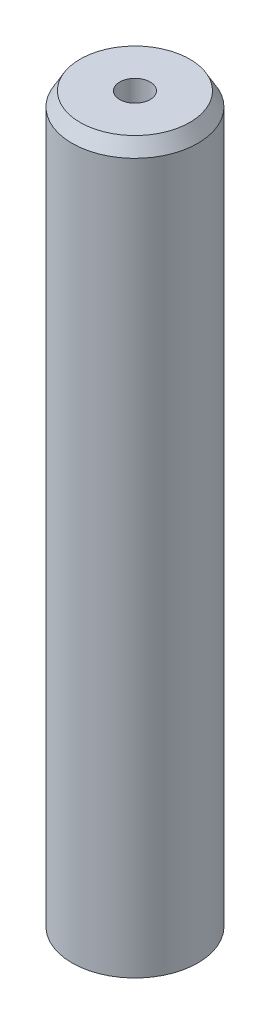
from build123d import *
from OCP.BRepFilletAPI import BRepFilletAPI_MakeChamfer

# Parameters (mm, degrees)
SKETCH1_R           = 7.5
BOSS_EXTRUDE1_DEPTH = 87.214622053
SKETCH2_R           = 1.815469713
CUT_EXTRUDE1_DEPTH  = 88.857215411
CHAMFER1_SIZE       = 1.671019409
CHAMFER1_SIZE2      = 0.964763506


with BuildPart() as part:
    # Sketch1 → Boss-Extrude1 (new body)
    with BuildSketch(Plane(origin=(0, 0, 0), x_dir=(1, 0, 0), z_dir=(0, 1, 0))):
        Circle(SKETCH1_R)
    extrude(amount=BOSS_EXTRUDE1_DEPTH)

    # Sketch2 → Cut-Extrude1 (cut, through all)
    with BuildSketch(Plane(origin=(0, 0, 0), x_dir=(1, 0, 0), z_dir=(0, 1, 0))):
        Circle(SKETCH2_R)
    extrude(amount=CUT_EXTRUDE1_DEPTH, mode=Mode.SUBTRACT)

    # Chamfer1: one chamfer whose edges measure the first distance from different faces: ONE call of the kernel's chamfer builder (chamfer() names one face for all edges)
    chamfer1_edges_1 = [part.edges().sort_by_distance(p)[0] for p in [
        (-7.5, 87.214622053, 0),
    ]]
    chamfer1_side_1 = [part.faces().sort_by_distance(p)[0] for p in [
        (-7.5, 43.607311027, 0),
    ]]
    chamfer1_edges_2 = [part.edges().sort_by_distance(p)[0] for p in [
        (-7.5, 0, 0),
    ]]
    chamfer1_side_2 = [part.faces().sort_by_distance(p)[0] for p in [
        (-7.287867966, 0, 0),
    ]]
    chamfer1 = BRepFilletAPI_MakeChamfer(part.part.solid().wrapped)
    for e in chamfer1_edges_1:
        chamfer1.Add(CHAMFER1_SIZE, CHAMFER1_SIZE2, e.wrapped, chamfer1_side_1[0].wrapped)  # the first distance lies on this face
    for e in chamfer1_edges_2:
        chamfer1.Add(CHAMFER1_SIZE, CHAMFER1_SIZE2, e.wrapped, chamfer1_side_2[0].wrapped)  # the first distance lies on this face
    add(Compound.cast(chamfer1.Shape()), mode=Mode.REPLACE)


solid = part.part
